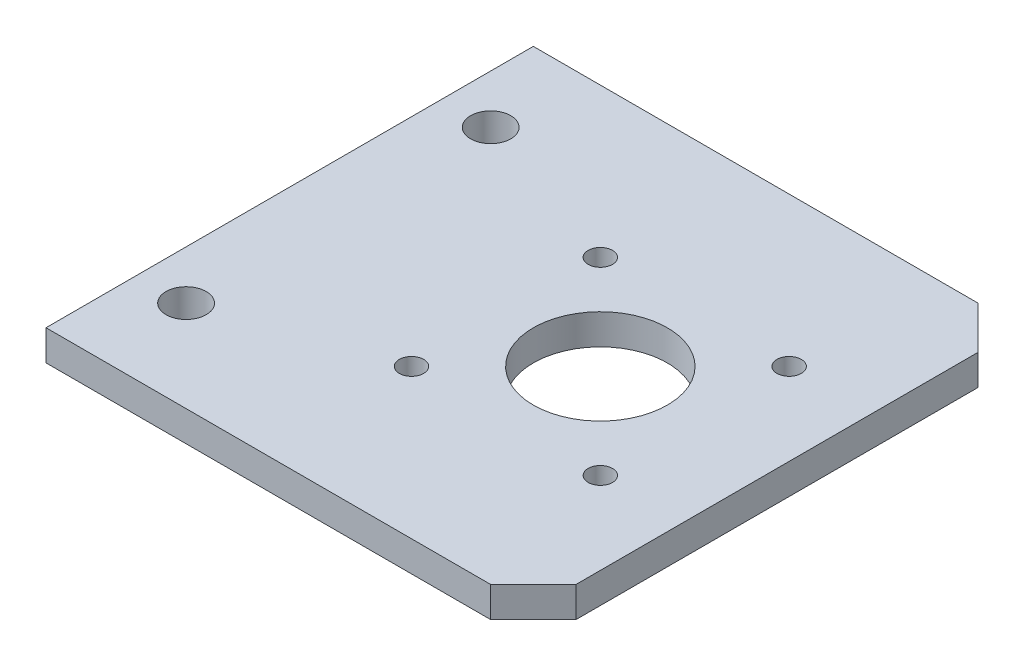
from build123d import *

# Parameters (mm, degrees)
SCHIZZO1_W                   = 80
SCHIZZO1_H                   = 5
ESTRUSIONE_ESTRUSIONE1_DEPTH = 80
FORO_PER_VITE_M6_1_D         = 6.6
SCHIZZO4_R                   = 11
TAGLIO_ESTRUSIONE1_DEPTH     = 114.247516529
SCHIZZO6_R                   = 2
TAGLIO_ESTRUSIONE3_DEPTH     = 114.247516529
CHAMFER1_SIZE                = 7


with BuildPart() as part:
    # Schizzo1 → Estrusione-Estrusione1 (new body)
    with BuildSketch(Plane.XY):
        with Locations((40, 2.5)):
            Rectangle(SCHIZZO1_W, SCHIZZO1_H)
    extrude(amount=ESTRUSIONE_ESTRUSIONE1_DEPTH)

    # Foro per Vite M6-1 (through all)
    with Locations(Plane(origin=(0, 5, 0), x_dir=(1, 0, 0), z_dir=(0, 1, 0))):
        with Locations((8, -15), (8, -65)):
            Hole(FORO_PER_VITE_M6_1_D / 2)

    # Schizzo4 → Taglio-Estrusione1 (cut, through all)
    with BuildSketch(Plane(origin=(0, 5, 0), x_dir=(1, 0, 0), z_dir=(0, 1, 0))):
        with Locations((51, -40)):
            Circle(SCHIZZO4_R)
    extrude(amount=-TAGLIO_ESTRUSIONE1_DEPTH, mode=Mode.SUBTRACT)

    # Schizzo6 → Taglio-Estrusione3 (cut, through all)
    with BuildSketch(Plane(origin=(0, 5, 0), x_dir=(1, 0, 0), z_dir=(0, 1, 0))):
        with Locations((35.5, -24.5)):
            Circle(SCHIZZO6_R)
        with Locations((66.5, -24.5)):
            Circle(SCHIZZO6_R)
        with Locations((66.5, -55.5)):
            Circle(SCHIZZO6_R)
        with Locations((35.5, -55.5)):
            Circle(SCHIZZO6_R)
    extrude(amount=-TAGLIO_ESTRUSIONE3_DEPTH, mode=Mode.SUBTRACT)

    # Chamfer1
    chamfer1_edges = [part.edges().sort_by_distance(p)[0] for p in [
        (80, 2.5, 0),
        (80, 2.5, 80),
    ]]
    chamfer(chamfer1_edges, length=CHAMFER1_SIZE)


solid = part.part
